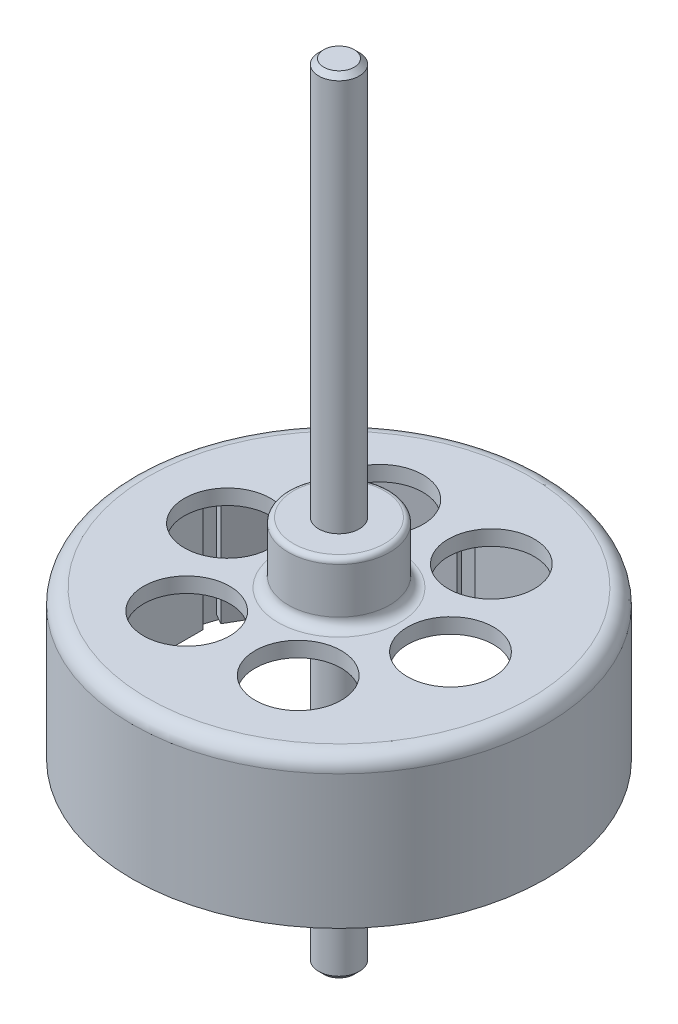
from build123d import *

# Parameters (mm, degrees)
SKETCH2_R          = 4.25
CUT_EXTRUDE1_DEPTH = 54.622383424
CHAMFER1_SIZE      = 0.5
CIRPATTERN1_START  = -59.4
CIRPATTERN1_DEPTH  = 12


# Read off the part's stored shape, not the designer's step: CirPattern1
with BuildPart() as part:
    # Sketch1 → Revolve1 (revolve)
    with BuildSketch(Plane.XY, mode=Mode.PRIVATE) as revolve1_sk:
        with BuildLine():
            Line((0, 0), (0, -77.5))
            Line((0, -77.5), (2, -77.5))
            Line((2, -77.5), (2, -46.7))
            Line((2, -46.7), (18.9, -46.7))
            Line((18.9, -46.7), (18.9, -59.9))
            Line((18.9, -59.9), (20.4, -59.9))
            Line((20.4, -59.9), (20.4, -46.7))
            ThreePointArc((20.4, -46.7), (19.960660172, -45.639339828), (18.9, -45.2))
            Line((18.9, -45.2), (6, -45.2))
            ThreePointArc((6, -45.2), (5.292893219, -44.907106781), (5, -44.2))
            Line((5, -44.2), (5, -39.7))
            ThreePointArc((5, -39.7), (4.853553391, -39.346446609), (4.5, -39.2))
            Line((4.5, -39.2), (2, -39.2))
            Line((2, -39.2), (2, 0))
            Line((2, 0), (0, 0))
        make_face()
    revolve(revolve1_sk.sketch.rotate(Axis((0, 0, 0), (0, -1, 0)), 180), axis=Axis((0, 0, 0), (0, -1, 0)))

    # Sketch2 → Cut-Extrude1 (cut, through all)
    with BuildSketch(Plane(origin=(0, -45.2, 0), x_dir=(1, 0, 0), z_dir=(0, 1, 0))):
        with Locations(Location((5.5, 9.526279442, 0), (0, 0, 180))):
            Circle(SKETCH2_R)
        with Locations(Location((11, 0, 0), (0, 0, 180))):
            Circle(SKETCH2_R)
        with Locations(Location((5.5, -9.526279442, 0), (0, 0, 180))):
            Circle(SKETCH2_R)
        with Locations(Location((-5.5, -9.526279442, 0), (0, 0, 180))):
            Circle(SKETCH2_R)
        with Locations(Location((-11, 0, 0), (0, 0, 180))):
            Circle(SKETCH2_R)
        with Locations(Location((-5.5, 9.526279442, 0), (0, 0, 180))):
            Circle(SKETCH2_R)
    extrude(amount=-CUT_EXTRUDE1_DEPTH, mode=Mode.SUBTRACT)

    # Chamfer1
    chamfer1_edges = [part.edges().sort_by_distance(p)[0] for p in [
        (2, 0, 0),
        (2, -77.5, 0),
    ]]
    chamfer(chamfer1_edges, length=CHAMFER1_SIZE)

    # CirPattern1 outline → CirPattern1 (add)
    with BuildSketch(Plane(origin=(0, 0, 0), x_dir=(1, 0, 0), z_dir=(0, 1, 0)).offset(CIRPATTERN1_START)):
        with BuildLine():
            ThreePointArc((-3.9, -18.493242009), (0, -18.9), (3.9, -18.493242009))
            Line((3.9, -18.493242009), (3.9, -17.3))
            Line((3.9, -17.3), (-3.9, -17.3))
            Line((-3.9, -17.3), (-3.9, -18.493242009))
        make_face()
        with BuildLine():
            Line((5.272500925, -16.932239485), (5.86912193, -17.965617378))
            ThreePointArc((5.86912193, -17.965617378), (9.45, -16.367880131), (12.624120079, -14.065617378))
            Line((12.624120079, -14.065617378), (12.027499075, -13.032239485))
            Line((12.027499075, -13.032239485), (5.272500925, -16.932239485))
        make_face()
        with BuildLine():
            ThreePointArc((-12.624120079, -14.065617378), (-9.45, -16.367880131), (-5.86912193, -17.965617378))
            Line((-5.86912193, -17.965617378), (-5.272500925, -16.932239485))
            Line((-5.272500925, -16.932239485), (-12.027499075, -13.032239485))
            Line((-12.027499075, -13.032239485), (-12.624120079, -14.065617378))
        make_face()
        with BuildLine():
            Line((13.032239485, -12.027499075), (14.065617378, -12.624120079))
            ThreePointArc((14.065617378, -12.624120079), (16.367880131, -9.45), (17.965617378, -5.86912193))
            Line((17.965617378, -5.86912193), (16.932239485, -5.272500925))
            Line((16.932239485, -5.272500925), (13.032239485, -12.027499075))
        make_face()
        with BuildLine():
            ThreePointArc((-17.965617378, -5.86912193), (-16.367880131, -9.45), (-14.065617378, -12.624120079))
            Line((-14.065617378, -12.624120079), (-13.032239485, -12.027499075))
            Line((-13.032239485, -12.027499075), (-16.932239485, -5.272500925))
            Line((-16.932239485, -5.272500925), (-17.965617378, -5.86912193))
        make_face()
        with BuildLine():
            Line((17.3, -3.9), (18.493242009, -3.9))
            ThreePointArc((18.493242009, -3.9), (18.9, 0), (18.493242009, 3.9))
            Line((18.493242009, 3.9), (17.3, 3.9))
            Line((17.3, 3.9), (17.3, -3.9))
        make_face()
        with BuildLine():
            ThreePointArc((-18.493242009, 3.9), (-18.9, 0), (-18.493242009, -3.9))
            Line((-18.493242009, -3.9), (-17.3, -3.9))
            Line((-17.3, -3.9), (-17.3, 3.9))
            Line((-17.3, 3.9), (-18.493242009, 3.9))
        make_face()
        with BuildLine():
            ThreePointArc((-14.065617378, 12.624120079), (-16.367880131, 9.45), (-17.965617378, 5.86912193))
            Line((-17.965617378, 5.86912193), (-16.932239485, 5.272500925))
            Line((-16.932239485, 5.272500925), (-13.032239485, 12.027499075))
            Line((-13.032239485, 12.027499075), (-14.065617378, 12.624120079))
        make_face()
        with BuildLine():
            Line((16.932239485, 5.272500925), (17.965617378, 5.86912193))
            ThreePointArc((17.965617378, 5.86912193), (16.367880131, 9.45), (14.065617378, 12.624120079))
            Line((14.065617378, 12.624120079), (13.032239485, 12.027499075))
            Line((13.032239485, 12.027499075), (16.932239485, 5.272500925))
        make_face()
        with BuildLine():
            ThreePointArc((-5.86912193, 17.965617378), (-9.45, 16.367880131), (-12.624120079, 14.065617378))
            Line((-12.624120079, 14.065617378), (-12.027499075, 13.032239485))
            Line((-12.027499075, 13.032239485), (-5.272500925, 16.932239485))
            Line((-5.272500925, 16.932239485), (-5.86912193, 17.965617378))
        make_face()
        with BuildLine():
            Line((12.027499075, 13.032239485), (12.624120079, 14.065617378))
            ThreePointArc((12.624120079, 14.065617378), (9.45, 16.367880131), (5.86912193, 17.965617378))
            Line((5.86912193, 17.965617378), (5.272500925, 16.932239485))
            Line((5.272500925, 16.932239485), (12.027499075, 13.032239485))
        make_face()
        with BuildLine():
            ThreePointArc((3.9, 18.493242009), (0, 18.9), (-3.9, 18.493242009))
            Line((-3.9, 18.493242009), (-3.9, 17.3))
            Line((-3.9, 17.3), (3.9, 17.3))
            Line((3.9, 17.3), (3.9, 18.493242009))
        make_face()
    extrude(amount=CIRPATTERN1_DEPTH)


solid = part.part
